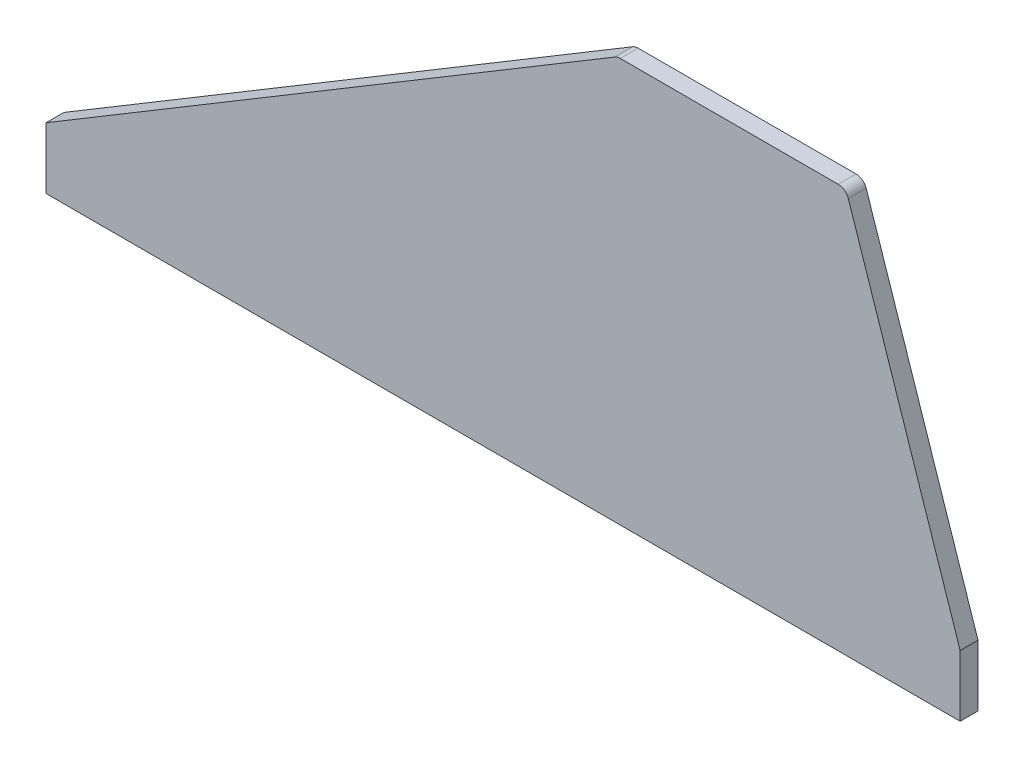
from build123d import *

# Parameters (mm, degrees)
FIN_BODY_DEPTH = 7.9375
FIN_FILLETS_R  = 4.7625


with BuildPart() as part:
    # Fin Profile → Fin Body (new body)
    with BuildSketch(Plane.XY):
        Polygon((406.4, -27.2542), (0, -27.2542), (0, 0), (254, 152.4), (355.6, 152.4), (406.4, 0), align=None)
    extrude(amount=FIN_BODY_DEPTH)

    # Fin Fillets
    fin_fillets_edges = [part.edges().sort_by_distance(p)[0] for p in [
        (355.6, 152.4, 3.96875),
        (254, 152.4, 3.96875),
    ]]
    fillet(fin_fillets_edges, radius=FIN_FILLETS_R)


solid = part.part
